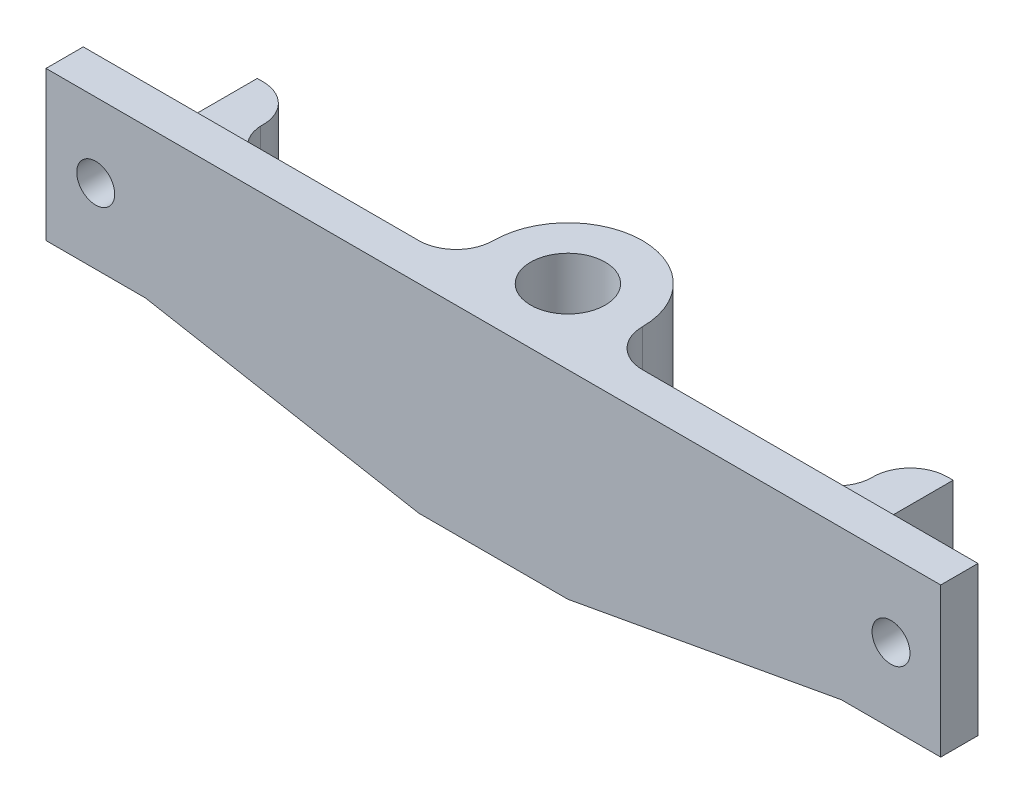
from build123d import *

# Parameters (mm, degrees)
BOSS_EXTRUDE5_DEPTH         = 4.7625
F_11_0_191_DIAMETER_HOLE1_D = 4.8514
BOSS_EXTRUDE6_DEPTH         = 25.4
CUT_EXTRUDE1_DEPTH          = 65.15150159
CUT_EXTRUDE1_DEPTH_BACK     = 65.15150159
SKETCH7_R                   = 4.7625
FILLET2_R                   = 4.7625
BOSS_EXTRUDE7_DEPTH         = 7.62


with BuildPart() as part:
    # Sketch3 → Boss-Extrude5 (new body)
    with BuildSketch(Plane.XY):
        Polygon((-57.15, 0), (57.15, 0), (57.15, -19.05), (44.45, -19.05), (9.525, -25.4), (-9.525, -25.4), (-44.45, -19.05), (-57.15, -19.05), align=None)
    extrude(amount=BOSS_EXTRUDE5_DEPTH)

    # #11 (0.191) Diameter Hole1 (through all)
    with Locations(Plane(origin=(50.8, -9.525, 4.7625), x_dir=(1, 0, 0), z_dir=(0, 0, 1))):
        with Locations((0, 0), (-101.6, 0)):
            Hole(F_11_0_191_DIAMETER_HOLE1_D / 2)

    # Sketch6 → Boss-Extrude6 (add)
    with BuildSketch(Plane.XZ.offset(25.4)):
        with BuildLine():
            Line((9.525, 0), (9.525, -4.7625))
            ThreePointArc((9.525, -4.7625), (0, -14.2875), (-9.525, -4.7625))
            Line((-9.525, -4.7625), (-9.525, 0))
            Line((-9.525, 0), (9.525, 0))
        make_face()
    extrude(amount=-BOSS_EXTRUDE6_DEPTH)

    # Sketch7 → Cut-Extrude1 (cut, two sides: drawn at the far end of the back side and taken through both)
    with BuildSketch(Plane.XZ.offset(25.4).offset(-CUT_EXTRUDE1_DEPTH_BACK)):
        with Locations((0, -4.7625)):
            Circle(SKETCH7_R)
    extrude(amount=CUT_EXTRUDE1_DEPTH + CUT_EXTRUDE1_DEPTH_BACK, mode=Mode.SUBTRACT)

    # Fillet2
    fillet2_edges = [part.edges().sort_by_distance(p)[0] for p in [
        (-9.525, -12.7, 0),
        (9.525, -12.7, 0),
    ]]
    fillet(fillet2_edges, radius=FILLET2_R - 0.0001)  # a hair under: the kernel refuses the full size

    # Sketch8 → Boss-Extrude7 (add, symmetric)
    with BuildSketch(Plane(origin=(0, -9.525, 0), x_dir=(-1, 0, 0), z_dir=(0, -1, 0))):
        with BuildLine():
            Line((-44.45, 0), (-44.45, 9.525))
            Line((-44.45, 9.525), (-43.723723681, 9.525))
            ThreePointArc((-43.723723681, 9.525), (-40.249716578, 8.02021099), (-38.971047095, 4.45676888))
            ThreePointArc((-38.971047095, 4.45676888), (-37.476081499, 1.288492897), (-34.218370509, 0))
            Line((-34.218370509, 0), (-44.45, 0))
        make_face()
    boss_extrude7 = extrude(amount=BOSS_EXTRUDE7_DEPTH, both=True)

    # Mirror1: Boss-Extrude7 across plane
    add(boss_extrude7.mirror(Plane(origin=(0, 0, 0), x_dir=(0, 0, 1), z_dir=(1, 0, 0))))


solid = part.part
